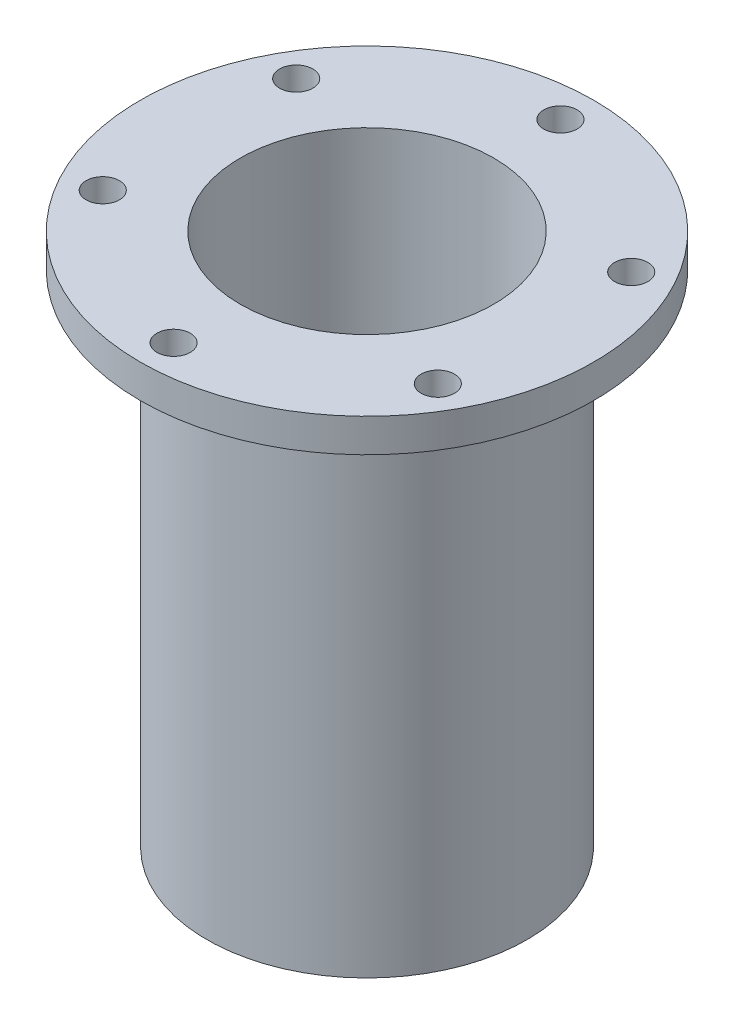
from build123d import *

# Parameters (mm, degrees)
SKETCH2_R          = 2.5
CUT_EXTRUDE1_DEPTH = 10


with BuildPart() as part:
    # Sketch1 → Revolve1 (revolve)
    with BuildSketch(Plane.XY):
        Polygon((19, 0), (19, 80), (34, 80), (34, 75), (24, 75), (24, 0), align=None)
    revolve(axis=Axis((0, 0, 0), (0, 1, 0)))

    # Sketch2 → Cut-Extrude1 (cut)
    with BuildSketch(Plane(origin=(0, 80, 0), x_dir=(1, 0, 0), z_dir=(0, 1, 0))):
        with Locations((0, 29)):
            Circle(SKETCH2_R)
        with Locations((25.11473671, 14.5)):
            Circle(SKETCH2_R)
        with Locations((25.11473671, -14.5)):
            Circle(SKETCH2_R)
        with Locations((0, -29)):
            Circle(SKETCH2_R)
        with Locations((-25.11473671, -14.5)):
            Circle(SKETCH2_R)
        with Locations((-25.11473671, 14.5)):
            Circle(SKETCH2_R)
    extrude(amount=-CUT_EXTRUDE1_DEPTH, mode=Mode.SUBTRACT)


solid = part.part
